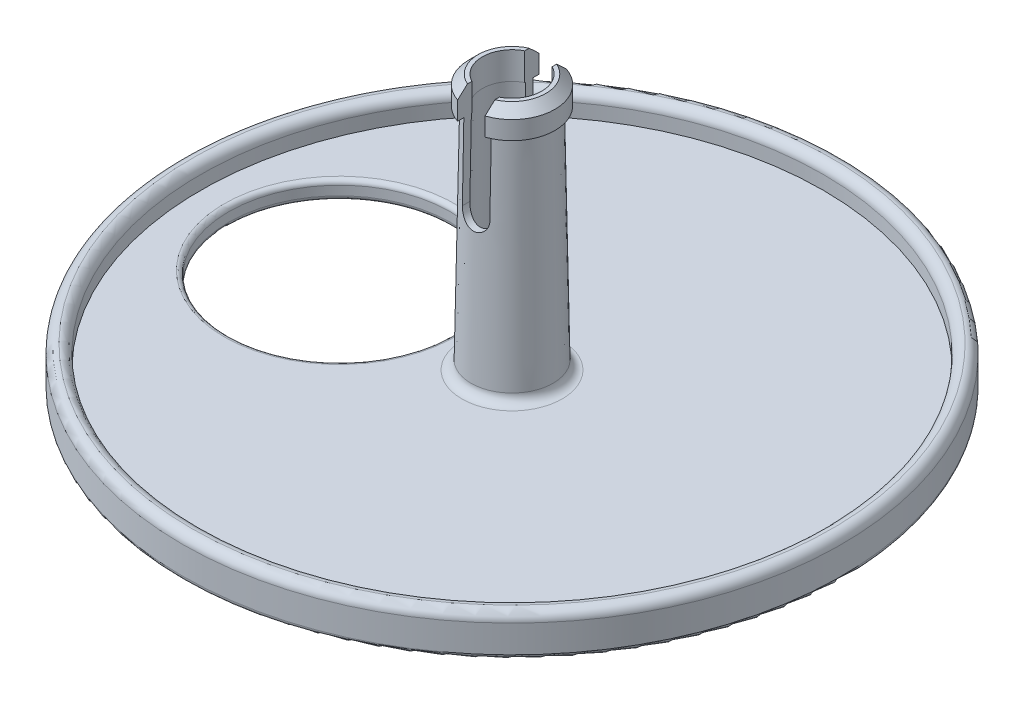
from build123d import *

# Parameters (mm, degrees)
SKETCH1_R               = 36
BOSS_EXTRUDE1_DEPTH     = 4.5
SHELL1_T                = -2
SKETCH2_R               = 4.5
BOSS_EXTRUDE2_DEPTH     = 28
BOSS_EXTRUDE2_TAPER     = 1.023
CUT_EXTRUDE1_DEPTH      = 28
CUT_EXTRUDE1_DEPTH_BACK = 28
SKETCH5_R               = 3.75
CUT_EXTRUDE2_DEPTH      = 28
CUT_EXTRUDE2_TAPER      = 1.023
FILLET1_R               = 1
FILLET2_R               = 1
BOSS_EXTRUDE3_DEPTH     = 3
CHAMFER1_SIZE           = 1
SKETCH8_R               = 12.1
CUT_EXTRUDE3_DEPTH      = 10
FILLET3_R               = 0.5
FILLET4_R               = 1


with BuildPart() as part:
    # Sketch1 → Boss-Extrude1 (new body)
    with BuildSketch(Plane(origin=(0, 0, 0), x_dir=(1, 0, 0), z_dir=(0, 1, 0))):
        with Locations(Location((0, 0, 0), (0, 0, 270))):
            Circle(SKETCH1_R)
    extrude(amount=BOSS_EXTRUDE1_DEPTH)

    # Shell1
    shell1_openings = [part.faces().sort_by_distance(p)[0] for p in [
        (0, 4.5, 0),
    ]]
    offset(amount=SHELL1_T, openings=shell1_openings, kind=Kind.INTERSECTION)

    # Sketch2 → Boss-Extrude2 (add)
    with BuildSketch(Plane(origin=(0, 2, 0), x_dir=(1, 0, 0), z_dir=(0, 1, 0))):
        Circle(SKETCH2_R)
    extrude(amount=BOSS_EXTRUDE2_DEPTH, taper=BOSS_EXTRUDE2_TAPER)

    # Sketch3 → Cut-Extrude1 (cut, two sides: drawn at the far end of the back side and taken through both)
    with BuildSketch(Plane.XY.offset(-CUT_EXTRUDE1_DEPTH_BACK)):
        with BuildLine():
            Line((-1.5, 18.75), (-1.5, 30))
            ThreePointArc((-1.5, 30), (0, 31.5), (1.5, 30))
            Line((1.5, 30), (1.5, 18.75))
            ThreePointArc((1.5, 18.75), (0, 17.25), (-1.5, 18.75))
        make_face()
    extrude(amount=CUT_EXTRUDE1_DEPTH + CUT_EXTRUDE1_DEPTH_BACK, mode=Mode.SUBTRACT)

    # Sketch5 → Cut-Extrude2 (cut)
    with BuildSketch(Plane(origin=(0, 2, 0), x_dir=(1, 0, 0), z_dir=(0, 1, 0))):
        Circle(SKETCH5_R)
    extrude(amount=CUT_EXTRUDE2_DEPTH, taper=CUT_EXTRUDE2_TAPER, mode=Mode.SUBTRACT)

    # Fillet1
    fillet1_edges = [part.edges().sort_by_distance(p)[0] for p in [
        (-3.75, 2, 0),
    ]]
    fillet(fillet1_edges, radius=FILLET1_R)

    # Fillet2
    fillet2_edges = [part.edges().sort_by_distance(p)[0] for p in [
        (0, 4.5, -36),
        (0, 4.5, -34),
    ]]
    fillet(fillet2_edges, radius=FILLET2_R - 0.0001)  # a hair under: the kernel refuses the full size

    # Sketch6 → Boss-Extrude3 (add)
    with BuildSketch(Plane(origin=(0, 30, 0), x_dir=(1, 0, 0), z_dir=(0, 1, 0))):
        with BuildLine():
            Line((1.5, 2.883157284), (1.5, 4.444412541))
            ThreePointArc((1.5, 4.444412541), (4.690714534, 0), (1.5, -4.444412541))
            Line((1.5, -4.444412541), (1.5, -2.883157284))
            ThreePointArc((1.5, -2.883157284), (3.250014758, 0), (1.5, 2.883157284))
        make_face()
        with BuildLine():
            Line((-1.5, 2.883157284), (-1.5, 4.444412541))
            ThreePointArc((-1.5, 4.444412541), (-4.690714534, 0), (-1.5, -4.444412541))
            Line((-1.5, -4.444412541), (-1.5, -2.883157284))
            ThreePointArc((-1.5, -2.883157284), (-3.250014758, 0), (-1.5, 2.883157284))
        make_face()
    extrude(amount=-BOSS_EXTRUDE3_DEPTH)

    # Chamfer1
    chamfer1_edges = [part.edges().sort_by_distance(p)[0] for p in [
        (4.690714534, 30, 0),
        (-4.690714534, 30, 0),
    ]]
    chamfer(chamfer1_edges, length=CHAMFER1_SIZE)

    # Sketch8 → Cut-Extrude3 (cut)
    with BuildSketch(Plane(origin=(0, 2, 0), x_dir=(1, 0, 0), z_dir=(0, 1, 0))):
        with Locations(Location((-18.85, 0, 0), (0, 0, 270))):
            Circle(SKETCH8_R)
    extrude(amount=-CUT_EXTRUDE3_DEPTH, mode=Mode.SUBTRACT)

    # Fillet3
    fillet3_edges = [part.edges().sort_by_distance(p)[0] for p in [
        (-18.85, 0, -12.1),
        (-18.85, 2, -12.1),
        (0, 0, -36),
    ]]
    fillet(fillet3_edges, radius=FILLET3_R)

    # Fillet4
    fillet4_edges = [part.edges().sort_by_distance(p)[0] for p in [
        (-4.5, 2, 0),
    ]]
    fillet(fillet4_edges, radius=FILLET4_R)


solid = part.part
